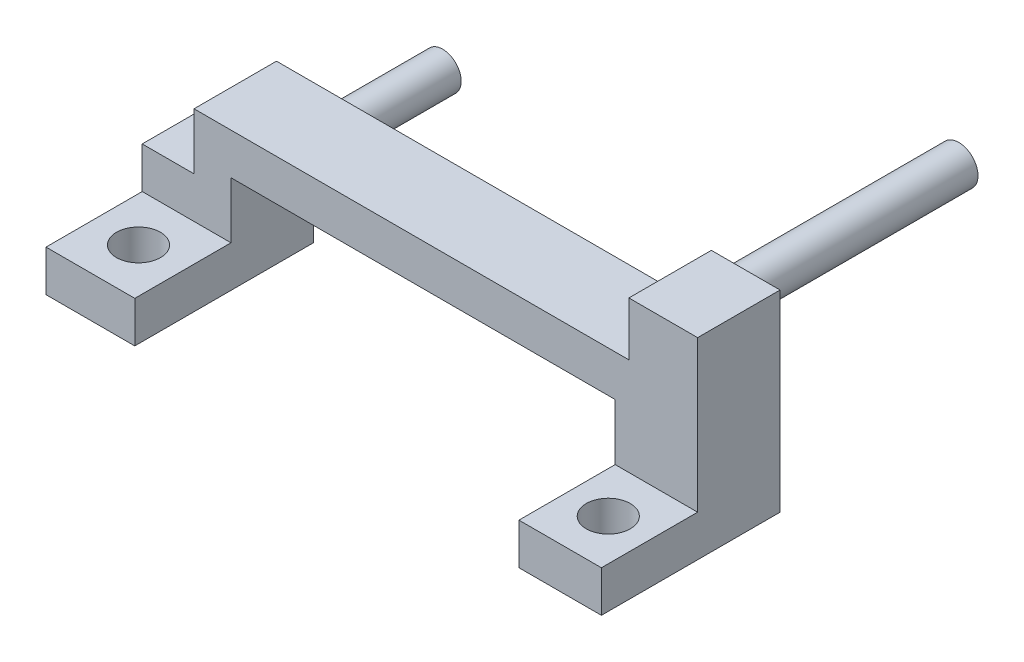
from build123d import *

# Parameters (mm, degrees)
SKETCH1_W            = 4
SKETCH1_H            = 14
BOSS_EXTRUDE1_DEPTH  = 3
SKETCH2_R            = 1.4
BOSS_EXTRUDE2_DEPTH  = 16
SKETCH3_W            = 4
SKETCH3_H            = 1
BOSS_EXTRUDE4_DEPTH  = 6
SKETCH7_W            = 3
SKETCH7_H            = 2
BOSS_EXTRUDE5_DEPTH  = 30.95
SKETCH8_W            = 3
SKETCH8_H            = 2
BOSS_EXTRUDE6_DEPTH  = 1
SKETCH9_W            = 1
SKETCH9_H            = 2
BOSS_EXTRUDE7_DEPTH  = 3
SKETCH10_W           = 1
SKETCH10_H           = 2
BOSS_EXTRUDE8_DEPTH  = 5.92
SKETCH11_W           = 1
SKETCH11_H           = 2
BOSS_EXTRUDE9_DEPTH  = 4
SKETCH12_W           = 1
SKETCH12_H           = 3
BOSS_EXTRUDE14_DEPTH = 0.93
SKETCH13_W           = 3
SKETCH13_H           = 3
BOSS_EXTRUDE15_DEPTH = 7.1
SKETCH14_W           = 3.33402541
SKETCH14_H           = 13.860919233
CUT_EXTRUDE3_DEPTH   = 10
SKETCH15_W           = 6.20666024
SKETCH15_H           = 3.660501205
CUT_EXTRUDE4_DEPTH   = 10
SKETCH16_W           = 3
SKETCH16_H           = 9.1
BOSS_EXTRUDE16_DEPTH = 0.12
SKETCH18_W           = 3
SKETCH18_H           = 9.1
BOSS_EXTRUDE18_DEPTH = 0.41
SKETCH19_W           = 3
SKETCH19_H           = 9.1
BOSS_EXTRUDE19_DEPTH = 0.89
SKETCH20_W           = 3
SKETCH20_H           = 6
BOSS_EXTRUDE20_DEPTH = 3.77
SKETCH21_R           = 1.35
BOSS_EXTRUDE23_DEPTH = 12
BOSS_EXTRUDE24_DEPTH = 3
SKETCH24_W           = 4
SKETCH24_H           = 1
BOSS_EXTRUDE25_DEPTH = 4
SKETCH25_W           = 4
SKETCH25_H           = 7
BOSS_EXTRUDE26_DEPTH = 2
SKETCH26_W           = 6.458993184
SKETCH26_H           = 3
BOSS_EXTRUDE27_DEPTH = 7
SKETCH27_R           = 1.6
CUT_EXTRUDE5_DEPTH   = 7
SKETCH28_R           = 1.6
CUT_EXTRUDE6_DEPTH   = 7
SKETCH30_W           = 7
SKETCH30_H           = 3
BOSS_EXTRUDE29_DEPTH = 1
SKETCH31_W           = 7
SKETCH31_H           = 3
BOSS_EXTRUDE30_DEPTH = 1
SKETCH32_W           = 6
SKETCH32_H           = 7.1
BOSS_EXTRUDE31_DEPTH = 1
SKETCH33_W           = 31.638993184
SKETCH33_H           = 6
BOSS_EXTRUDE32_DEPTH = 1
SKETCH34_W           = 6
SKETCH34_H           = 14
BOSS_EXTRUDE33_DEPTH = 1


with BuildPart() as part:
    # Sketch1 → Boss-Extrude1 (new body)
    with BuildSketch(Plane.XY):
        with Locations((-1.434146341, -3.597560976)):
            Rectangle(SKETCH1_W, SKETCH1_H)
    extrude(amount=BOSS_EXTRUDE1_DEPTH)

    # Sketch2 → Boss-Extrude2 (add)
    with BuildSketch(Plane(origin=(0, 0, 0), x_dir=(-1, 0, 0), z_dir=(0, 0, -1))):
        with Locations((1.434146341, 1.802439024)):
            Circle(SKETCH2_R)
    extrude(amount=BOSS_EXTRUDE2_DEPTH)

    # Sketch3 → Boss-Extrude4 (add)
    with BuildSketch(Plane.XY.offset(3)):
        with Locations((-1.434146341, -10.097560976)):
            Rectangle(SKETCH3_W, SKETCH3_H)
    extrude(amount=BOSS_EXTRUDE4_DEPTH)

    # Sketch7 → Boss-Extrude5 (add)
    with BuildSketch(Plane.ZY.offset(3.434146341)):
        with Locations((1.5, -2.497560976)):
            Rectangle(SKETCH7_W, SKETCH7_H)
    extrude(amount=BOSS_EXTRUDE5_DEPTH)

    # Sketch8 → Boss-Extrude6 (add)
    with BuildSketch(Plane.ZY.offset(34.384146341)):
        with Locations((1.5, -2.497560976)):
            Rectangle(SKETCH8_W, SKETCH8_H)
    extrude(amount=BOSS_EXTRUDE6_DEPTH)

    # Sketch9 → Boss-Extrude7 (add)
    with BuildSketch(Plane(origin=(0, 0, 0), x_dir=(-1, 0, 0), z_dir=(0, 0, -1))):
        with Locations((34.884146341, -2.497560976)):
            Rectangle(SKETCH9_W, SKETCH9_H)
    extrude(amount=BOSS_EXTRUDE7_DEPTH)

    # Sketch10 → Boss-Extrude8 (add)
    with BuildSketch(Plane(origin=(0, 0, -3), x_dir=(-1, 0, 0), z_dir=(0, 0, -1))):
        with Locations((34.884146341, -2.497560976)):
            Rectangle(SKETCH10_W, SKETCH10_H)
    extrude(amount=BOSS_EXTRUDE8_DEPTH)

    # Sketch11 → Boss-Extrude9 (add)
    with BuildSketch(Plane(origin=(0, 0, -8.92), x_dir=(-1, 0, 0), z_dir=(0, 0, -1))):
        with Locations((34.884146341, -2.497560976)):
            Rectangle(SKETCH11_W, SKETCH11_H)
    extrude(amount=BOSS_EXTRUDE9_DEPTH)

    # Sketch12 → Boss-Extrude14 (add)
    with BuildSketch(Plane.XZ.offset(3.497560976)):
        with Locations((-34.884146341, -9.28)):
            Rectangle(SKETCH12_W, SKETCH12_H)
    extrude(amount=BOSS_EXTRUDE14_DEPTH)

    # Sketch13 → Boss-Extrude15 (add)
    with BuildSketch(Plane.XZ.offset(3.497560976)):
        with Locations((-33.884146341, 1.5)):
            Rectangle(SKETCH13_W, SKETCH13_H)
    extrude(amount=BOSS_EXTRUDE15_DEPTH)

    # Sketch14 → Cut-Extrude3 (cut)
    with BuildSketch(Plane.XY.offset(3)):
        with Locations((-35.32015223, -3.66710136)):
            Rectangle(SKETCH14_W, SKETCH14_H)
    extrude(amount=-CUT_EXTRUDE3_DEPTH, mode=Mode.SUBTRACT)


with BuildPart() as cut_extrude3_piece_1:
    # of the separate pieces the step leaves, piece 1, a body of its own (cut_extrude3_pieces)
    add(part.part.solids().sort_by_distance((-3.434146341, 3.402439024, 0))[0])

    # Sketch16 → Boss-Extrude16 (add)
    with BuildSketch(Plane.ZY.offset(33.653139525)):
        with Locations((1.5, -6.047560976)):
            Rectangle(SKETCH16_W, SKETCH16_H)
    extrude(amount=BOSS_EXTRUDE16_DEPTH)

    # Sketch18 → Boss-Extrude18 (add)
    with BuildSketch(Plane.ZY.offset(33.773139525)):
        with Locations((1.5, -6.047560976)):
            Rectangle(SKETCH18_W, SKETCH18_H)
    extrude(amount=BOSS_EXTRUDE18_DEPTH)

    # Sketch19 → Boss-Extrude19 (add)
    with BuildSketch(Plane.ZY.offset(34.183139525)):
        with Locations((1.5, -6.047560976)):
            Rectangle(SKETCH19_W, SKETCH19_H)
    extrude(amount=BOSS_EXTRUDE19_DEPTH)

    # Sketch20 → Boss-Extrude20 (add)
    with BuildSketch(Plane.ZY.offset(35.073139525)):
        with Locations((1.5, -7.597560976)):
            Rectangle(SKETCH20_W, SKETCH20_H)
    extrude(amount=BOSS_EXTRUDE20_DEPTH)

    # Sketch21 → Boss-Extrude23 (add)
    with BuildSketch(Plane(origin=(0, 0, 0), x_dir=(-1, 0, 0), z_dir=(0, 0, -1))):
        with Locations((34.984146341, -7.047560976)):
            Circle(SKETCH21_R)
    extrude(amount=BOSS_EXTRUDE23_DEPTH)

    # Sketch23 → Boss-Extrude24 (add)
    with BuildSketch(Plane.XY.offset(3)):
        Polygon((-38.843139525, -10.597560976), (-38.843139525, -4.597560976), (-35.073139525, -4.597560976), (-35.073139525, -1.497560976), (-3.434146341, -1.497560976), (-3.434146341, 3.402439024), (0.565853659, 3.402439024), (0.565853659, -9.597560976), (-3.434146341, -9.597560976), (-3.434146341, -3.497560976), (-32.384146341, -3.497560976), (-32.384146341, -10.597560976), align=None)
    extrude(amount=BOSS_EXTRUDE24_DEPTH)

    # Sketch24 → Boss-Extrude25 (add)
    with BuildSketch(Plane.XY.offset(9)):
        with Locations((-1.434146341, -10.097560976)):
            Rectangle(SKETCH24_W, SKETCH24_H)
    extrude(amount=BOSS_EXTRUDE25_DEPTH)

    # Sketch25 → Boss-Extrude26 (add)
    with BuildSketch(Plane(origin=(0, -9.597560976, 0), x_dir=(1, 0, 0), z_dir=(0, 1, 0))):
        with Locations((-1.434146341, -9.5)):
            Rectangle(SKETCH25_W, SKETCH25_H)
    extrude(amount=BOSS_EXTRUDE26_DEPTH)

    # Sketch26 → Boss-Extrude27 (add)
    with BuildSketch(Plane.XY.offset(6)):
        with Locations((-35.613642933, -9.097560976)):
            Rectangle(SKETCH26_W, SKETCH26_H)
    extrude(amount=BOSS_EXTRUDE27_DEPTH)

    # Sketch27 → Cut-Extrude5 (cut)
    with BuildSketch(Plane(origin=(0, -7.597560976, 0), x_dir=(1, 0, 0), z_dir=(0, 1, 0))):
        with Locations((-35.613642933, -9.5)):
            Circle(SKETCH27_R)
    extrude(amount=-CUT_EXTRUDE5_DEPTH, mode=Mode.SUBTRACT)

    # Sketch28 → Cut-Extrude6 (cut)
    with BuildSketch(Plane(origin=(0, -7.597560976, 0), x_dir=(1, 0, 0), z_dir=(0, 1, 0))):
        with Locations((-1.434146341, -9.5)):
            Circle(SKETCH28_R)
    extrude(amount=-CUT_EXTRUDE6_DEPTH, mode=Mode.SUBTRACT)

    # Sketch30 → Boss-Extrude29 (add)
    with BuildSketch(Plane(origin=(0.565853659, 0, 0), x_dir=(0, 0, -1), z_dir=(1, 0, 0))):
        with Locations((-9.5, -9.097560976)):
            Rectangle(SKETCH30_W, SKETCH30_H)
    extrude(amount=BOSS_EXTRUDE29_DEPTH)

    # Sketch31 → Boss-Extrude30 (add)
    with BuildSketch(Plane.ZY.offset(3.434146341)):
        with Locations((9.5, -9.097560976)):
            Rectangle(SKETCH31_W, SKETCH31_H)
    extrude(amount=BOSS_EXTRUDE30_DEPTH)

    # Sketch32 → Boss-Extrude31 (add)
    with BuildSketch(Plane.ZY.offset(3.434146341)):
        with Locations((3, -7.047560976)):
            Rectangle(SKETCH32_W, SKETCH32_H)
    extrude(amount=BOSS_EXTRUDE31_DEPTH)

    # Sketch33 → Boss-Extrude32 (add)
    with BuildSketch(Plane(origin=(0, -1.497560976, 0), x_dir=(1, 0, 0), z_dir=(0, 1, 0))):
        with Locations((-19.253642933, -3)):
            Rectangle(SKETCH33_W, SKETCH33_H)
    extrude(amount=BOSS_EXTRUDE32_DEPTH)

    # Sketch34 → Boss-Extrude33 (add)
    with BuildSketch(Plane(origin=(0.565853659, 0, 0), x_dir=(0, 0, -1), z_dir=(1, 0, 0))):
        with Locations((-3, -3.597560976)):
            Rectangle(SKETCH34_W, SKETCH34_H)
    extrude(amount=BOSS_EXTRUDE33_DEPTH)


with BuildPart() as cut_extrude3_piece_2:
    # of the separate pieces the step leaves, piece 2, a body of its own (cut_extrude3_pieces)
    add(part.part.solids().sort_by_distance((-34.384146341, -1.497560976, -7))[0])

    # Sketch15 → Cut-Extrude4 (cut)
    with BuildSketch(Plane.ZY.offset(35.384146341)):
        with Locations((-9.81666988, -3.327811578)):
            Rectangle(SKETCH15_W, SKETCH15_H)
    extrude(amount=-CUT_EXTRUDE4_DEPTH, mode=Mode.SUBTRACT)


solid = cut_extrude3_piece_1.part
